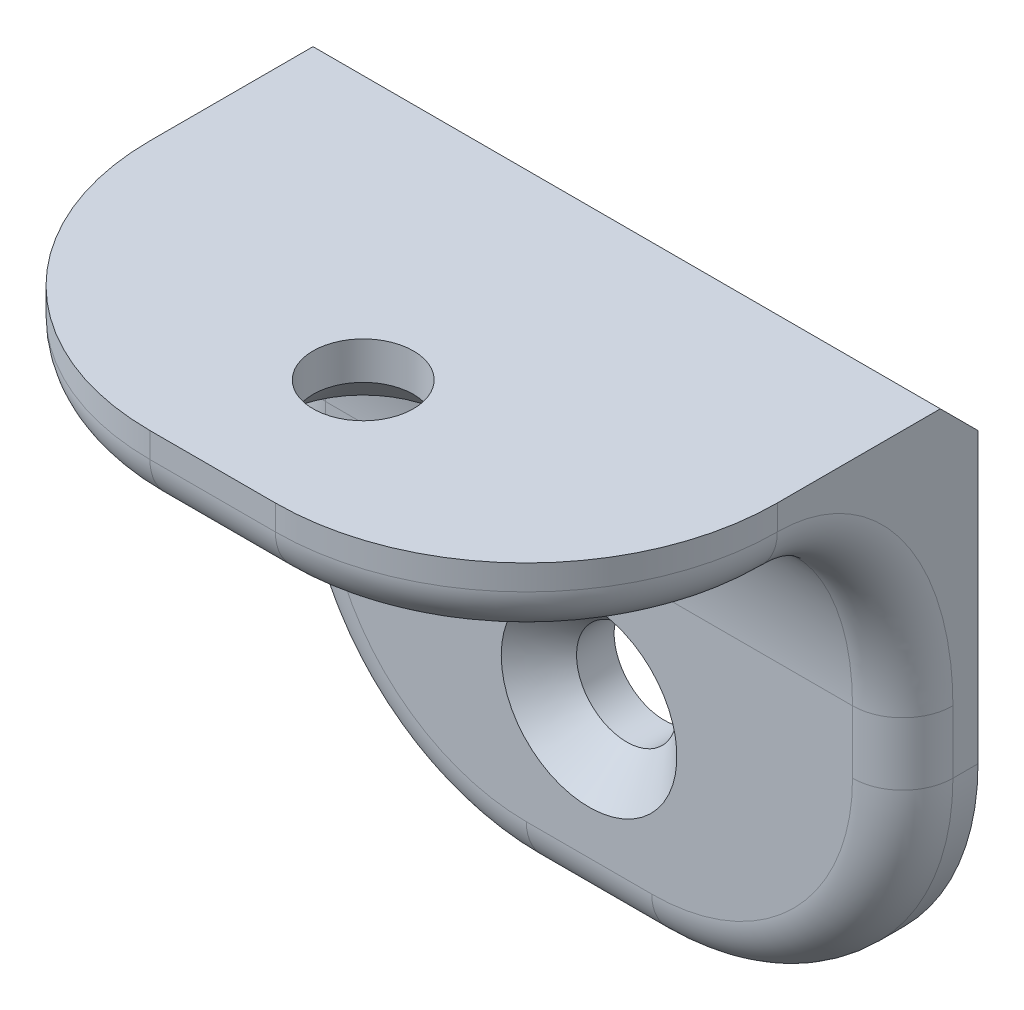
from build123d import *

# Parameters (mm, degrees)
BOSS_EXTRUDE1_DEPTH = 31.75
FILLET3_R           = 12.7
FILLET1_SIZE        = 9.525
FILLET1_SIZE_2      = 6.35
FILLET2_R           = 2.54
SKETCH3_R           = 2.54
CUT_EXTRUDE1_DEPTH  = 48.161309524
SKETCH4_R           = 2.54
CUT_EXTRUDE2_DEPTH  = 45.901280775
CHAMFER1_SIZE       = 1.905


with BuildPart() as part:
    # Sketch1 → Boss-Extrude1 (new body)
    with BuildSketch(Plane(origin=(0, 0, 0), x_dir=(0, 0, -1), z_dir=(1, 0, 0))):
        Polygon((0, 0), (0, 25.4), (-19.05, 25.4), (-19.05, 29.21), (3.81, 29.21), (3.81, 0), align=None)
    extrude(amount=BOSS_EXTRUDE1_DEPTH)

    # Fillet3
    fillet3_edges = [part.edges().sort_by_distance(p)[0] for p in [
        (31.75, 27.305, 19.05),
        (31.75, 0, -1.905),
        (0, 27.305, 19.05),
        (0, 0, -1.905),
    ]]
    fillet(fillet3_edges, radius=FILLET3_R)

    # Fillet1
    # an asymmetric fillet: 9.525, 6.35 mm, written as the material it adds along each edge
    with BuildSketch(Plane(origin=(0, 25.4, 0), x_dir=(0, -1, 0), z_dir=(1, 0, 0))) as fillet1_piece_1:
        with BuildLine():
            Bezier((FILLET1_SIZE, 0), (0, 0), (0, -FILLET1_SIZE_2), weights=[1, 0.707106781, 1])
            Line((0, -FILLET1_SIZE_2), (0, 0))
            Line((0, 0), (FILLET1_SIZE, 0))
        make_face()
    extrude(amount=31.75)

    # Fillet2
    fillet2_edges = [part.edges().sort_by_distance(p)[0] for p in [
        (15.875, 0, 0),
        (15.875, 25.4, 19.05),
        (28.030256121, 25.4, 15.330256121),
        (31.75, 21.935812925, 1.451375627),
        (31.75, 14.2875, 0),
        (28.030256121, 3.719743879, 0),
        (3.719743879, 3.719743879, 0),
        (0, 14.2875, 0),
        (0, 21.935812925, 1.451375627),
        (3.719743879, 25.4, 15.330256121),
    ]]
    fillet(fillet2_edges, radius=FILLET2_R)

    # Sketch3 → Cut-Extrude1 (cut, through all)
    with BuildSketch(Plane.XY):
        with Locations((15.875, 9.2075)):
            Circle(SKETCH3_R)
    extrude(amount=-CUT_EXTRUDE1_DEPTH, mode=Mode.SUBTRACT)

    # Sketch4 → Cut-Extrude2 (cut, through all)
    with BuildSketch(Plane.XZ.offset(-25.4)):
        with Locations(Location((15.875, 11.43, 0), (0, 0, 270))):
            Circle(SKETCH4_R)
    extrude(amount=-CUT_EXTRUDE2_DEPTH, mode=Mode.SUBTRACT)

    # Chamfer1
    chamfer1_edges = [part.edges().sort_by_distance(p)[0] for p in [
        (15.875, 29.21, -3.81),
        (13.335, 9.2075, 0),
        (15.875, 25.4, 13.97),
    ]]
    chamfer(chamfer1_edges, length=CHAMFER1_SIZE)


solid = part.part
